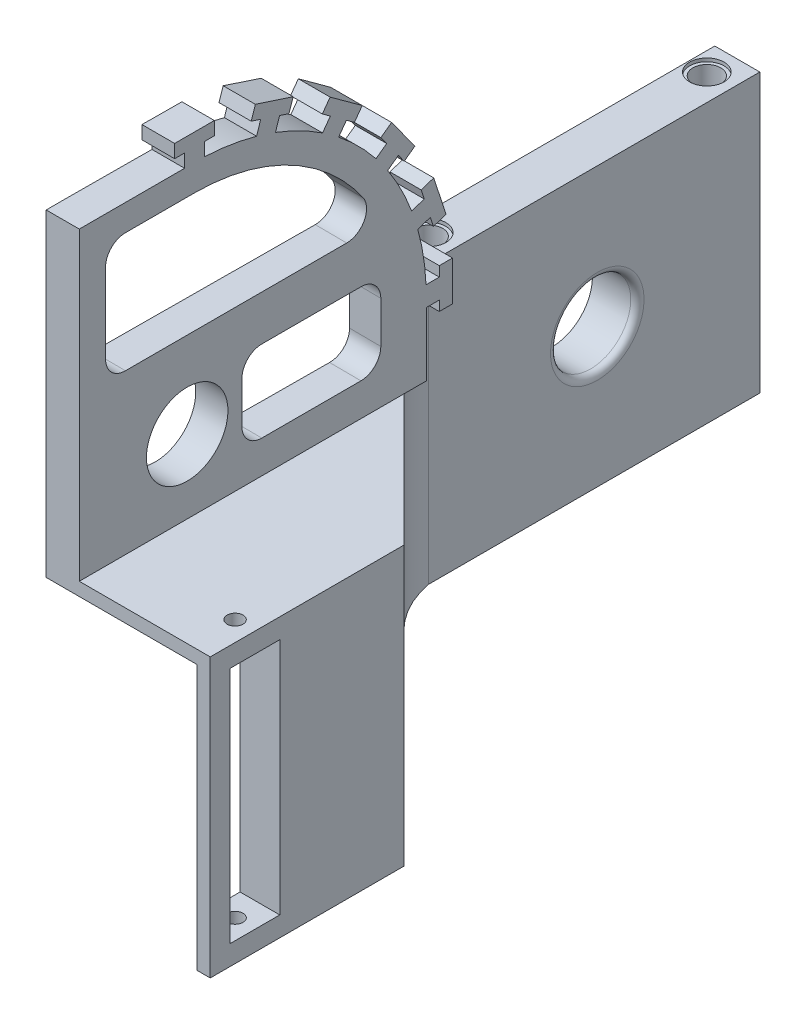
from build123d import *

# Parameters (mm, degrees)
SKETCH1_W           = 25
SKETCH1_H           = 50
SKETCH1_R           = 3.4
BOSS_EXTRUDE1_DEPTH = 3
SKETCH2_W           = 50
SKETCH2_H           = 3
BOSS_EXTRUDE2_DEPTH = 8
SKETCH3_W           = 8
SKETCH3_H           = 50
BOSS_EXTRUDE3_DEPTH = 42
SKETCH4_R           = 2.65
CUT_EXTRUDE1_DEPTH  = 0.5
SKETCH5_R           = 6.062177826
CUT_EXTRUDE2_DEPTH  = 9
FILLET2_R           = 1
SKETCH6_R           = 12.6
BOSS_EXTRUDE4_DEPTH = 2
FILLET4_R           = 1
SKETCH8_R           = 1.589780168
SKETCH8_R_2         = 1.777428262
CUT_EXTRUDE3_DEPTH  = 10
SKETCH9_W           = 49.021678163
SKETCH9_H           = 20.976854622
CUT_EXTRUDE4_DEPTH  = 68.79439129
SKETCH11_R          = 2.1
CUT_EXTRUDE5_DEPTH  = 59.480168703
SKETCH14_R          = 2.6
CUT_EXTRUDE6_DEPTH  = 0.5
BOSS_EXTRUDE5_DEPTH = 42
FILLET5_R           = 15
BOSS_EXTRUDE6_DEPTH = 42
SKETCH18_W          = 7.5
SKETCH18_H          = 36
CUT_EXTRUDE7_DEPTH  = 8
SKETCH19_R          = 1.2
CUT_EXTRUDE8_DEPTH  = 96.073366415
FILL_START          = -24.41711757
FILL_PATTERN1_DEPTH = 4.904046836
CHAMFER1_SIZE       = 4
CUT_EXTRUDE9_DEPTH  = 96.073366415
BOSS_EXTRUDE7_DEPTH = 2
BOSS_EXTRUDE8_DEPTH = 55
BOSS_EXTRUDE9_DEPTH = 4
SKETCH24_R          = 6.15
CUT_EXTRUDE10_DEPTH = 6
SKETCH25_W          = 50
SKETCH25_H          = 42
CUT_EXTRUDE11_DEPTH = 1.2
CUT_EXTRUDE14_DEPTH = 10
CUT_EXTRUDE15_DEPTH = 10


# Read off the part's stored shape, not the designer's step: Fill Pattern1
with BuildPart() as part:
    # Sketch1 → Boss-Extrude1 (new body)
    with BuildSketch(Plane(origin=(0, 0, 0), x_dir=(1, 0, 0), z_dir=(0, 1, 0))):
        with Locations((2.276951673, 11.384758364)):
            Rectangle(SKETCH1_W, SKETCH1_H)
        with Locations(Location((1.276951673, 11.384758364, 0), (0, 0, 270))):
            Circle(SKETCH1_R, mode=Mode.SUBTRACT)
    extrude(amount=BOSS_EXTRUDE1_DEPTH)

    # Sketch2 → Boss-Extrude2 (add)
    with BuildSketch(Plane.ZY.offset(10.223048327)):
        with Locations((-11.384758364, 1.5)):
            Rectangle(SKETCH2_W, SKETCH2_H)
    extrude(amount=BOSS_EXTRUDE2_DEPTH)

    # Sketch3 → Boss-Extrude3 (add)
    with BuildSketch(Plane.XZ):
        with Locations((-14.223048327, -11.384758364)):
            Rectangle(SKETCH3_W, SKETCH3_H)
    extrude(amount=BOSS_EXTRUDE3_DEPTH)

    # Sketch4 → Cut-Extrude1 (cut)
    with BuildSketch(Plane(origin=(0, 3, 0), x_dir=(1, 0, 0), z_dir=(0, 1, 0))):
        with Locations(Location((-14.223048327, 32.384758364, 0), (0, 0, 270))):
            Circle(SKETCH4_R)
        with Locations(Location((-14.223048327, -9.615241636, 0), (0, 0, 270))):
            Circle(SKETCH4_R)
    cut_extrude1 = extrude(amount=-CUT_EXTRUDE1_DEPTH, mode=Mode.SUBTRACT)

    # Mirror1: Cut-Extrude1 across plane
    add(cut_extrude1.mirror(Plane.ZX.offset(-19.5)), mode=Mode.SUBTRACT)

    # Sketch5 → Cut-Extrude2 (cut)
    with BuildSketch(Plane.ZY.offset(18.223048327)):
        with Locations((-11.836279124, -21)):
            Circle(SKETCH5_R)
    extrude(amount=-CUT_EXTRUDE2_DEPTH, mode=Mode.SUBTRACT)

    # Fillet2
    fillet2_edges = [part.edges().sort_by_distance(p)[0] for p in [
        (-10.223048327, -21, -17.89845695),
    ]]
    fillet(fillet2_edges, radius=FILLET2_R)

    # Mirror2: Cut-Extrude1 across plane
    add(cut_extrude1.mirror(Plane.ZY.offset(1.723048327)), mode=Mode.SUBTRACT)

    # Sketch6 → Boss-Extrude4 (add)
    with BuildSketch(Plane(origin=(0, 3, 0), x_dir=(1, 0, 0), z_dir=(0, 1, 0))):
        with BuildLine():
            Line((14.776951673, 5.825082115), (14.776951673, 16.944434614))
            ThreePointArc((14.776951673, 16.944434614), (-13.323048327, 11.384758364), (14.776951673, 5.825082115))
        make_face()
        with Locations(Location((1.276951673, 11.384758364, 0), (0, 0, 270))):
            Circle(SKETCH6_R, mode=Mode.SUBTRACT)
    extrude(amount=BOSS_EXTRUDE4_DEPTH)

    # Fillet4
    # the kernel refuses this fillet: 1 mm, written as the material it takes off along each edge
    with BuildSketch(Plane(origin=(14.776951673, 5, -3.325082115), x_dir=(0, -1, 0), z_dir=(0, 0, -1))) as fillet4_piece_1:
        with BuildLine():
            CenterArc((FILLET4_R, FILLET4_R), FILLET4_R, 180, 90)
            Line((0, FILLET4_R), (0, 0))
            Line((0, 0), (FILLET4_R, 0))
        make_face()
    extrude(amount=16.119352499, mode=Mode.SUBTRACT)

    # Sketch8 → Cut-Extrude3 (cut)
    with BuildSketch(Plane(origin=(0, 3, 0), x_dir=(1, 0, 0), z_dir=(0, 1, 0))):
        with Locations(Location((1.276951673, 19.884758364, 0), (0, 0, 270))):
            Circle(SKETCH8_R)
        with Locations(Location((1.276951673, 2.884758364, 0), (0, 0, 270))):
            Circle(SKETCH8_R_2)
    extrude(amount=-CUT_EXTRUDE3_DEPTH, mode=Mode.SUBTRACT)

    # Sketch9 → Cut-Extrude4 (cut, through all)
    with BuildSketch(Plane.XY.offset(13.615241636)):
        with Locations((-9.733887409, 10.488427311)):
            Rectangle(SKETCH9_W, SKETCH9_H)
    extrude(amount=-CUT_EXTRUDE4_DEPTH, mode=Mode.SUBTRACT)

    # Sketch11 → Cut-Extrude5 (cut, through all)
    with BuildSketch(Plane(origin=(0, 0, 0), x_dir=(1, 0, 0), z_dir=(0, 1, 0))):
        with Locations(Location((-14.223048327, 32.384758364, 0), (0, 0, 270))):
            Circle(SKETCH11_R)
    cut_extrude5 = extrude(amount=-CUT_EXTRUDE5_DEPTH, mode=Mode.SUBTRACT)

    # Mirror3: Cut-Extrude5 across plane
    add(cut_extrude5.mirror(Plane.XY.offset(-11.384758364)), mode=Mode.SUBTRACT)

    # Sketch14 → Cut-Extrude6 (cut)
    with BuildSketch(Plane(origin=(0, 0, 0), x_dir=(1, 0, 0), z_dir=(0, 1, 0))):
        with Locations(Location((-14.223048327, -9.615241636, 0), (0, 0, 270))):
            Circle(SKETCH14_R)
    cut_extrude6 = extrude(amount=-CUT_EXTRUDE6_DEPTH, mode=Mode.SUBTRACT)

    # Mirror4: Cut-Extrude6 across plane
    add(cut_extrude6.mirror(Plane.XY.offset(-11.384758364)), mode=Mode.SUBTRACT)

    # Sketch16 → Boss-Extrude5 (add)
    with BuildSketch(Plane(origin=(0, 0, 0), x_dir=(1, 0, 0), z_dir=(0, 1, 0))):
        Polygon((-18.223048327, -13.615241636), (24.776951673, -56.615241636), (24.776951673, -52.372600949), (-13.98040764, -13.615241636), align=None)
    extrude(amount=-BOSS_EXTRUDE5_DEPTH)

    # Fillet5
    # the kernel refuses this fillet: 15 mm, written as the material it adds along each edge
    with BuildSketch(Plane(origin=(-13.98040764, 0, 13.615241636), x_dir=(1, 0, 0), z_dir=(0, -1, 0))) as fillet5_piece_1:
        with BuildLine():
            CenterArc((18.512169169, -2.701034267), FILLET5_R, 135, 34.626223963)
            Line((7.905567451, 7.905567451), (0, 0))
            Line((0, 0), (3.757359313, 0))
        make_face()
    extrude(amount=42)

    # Sketch17 → Boss-Extrude6 (add)
    with BuildSketch(Plane(origin=(0, 0, 0), x_dir=(1, 0, 0), z_dir=(0, 1, 0))):
        Polygon((24.776951673, -56.615241636), (24.776951673, -81.615241636), (18.776951673, -81.615241636), (18.776951673, -50.615241636), align=None)
    extrude(amount=-BOSS_EXTRUDE6_DEPTH)

    # Sketch18 → Cut-Extrude7 (cut)
    with BuildSketch(Plane(origin=(24.776951673, 0, 0), x_dir=(0, 0, -1), z_dir=(1, 0, 0))):
        with Locations((-74.865241636, -21)):
            Rectangle(SKETCH18_W, SKETCH18_H)
    extrude(amount=-CUT_EXTRUDE7_DEPTH, mode=Mode.SUBTRACT)

    # Sketch19 → Cut-Extrude8 (cut, through all)
    with BuildSketch(Plane(origin=(0, 0, 0), x_dir=(1, 0, 0), z_dir=(0, 1, 0))):
        with Locations(Location((21.776951673, -74.865241636, 0), (0, 0, 270))):
            Circle(SKETCH19_R)
    extrude(amount=-CUT_EXTRUDE8_DEPTH, mode=Mode.SUBTRACT)

    # Fill Pattern1 outline → Fill Pattern1 (cut)
    with BuildSketch(Plane(origin=(0, 0, 0), x_dir=(0.7071067811865468, 0, 0.7071067811865482), z_dir=(0.7071067811865481, 0, -0.707106781186547)).offset(FILL_START)):
        Polygon((45.971737286, 5.859685187), (47.221737286, 3.694621678), (49.721737286, 3.694621678), (50.971737286, 5.859685187), (49.721737286, 8.024748697), (47.221737286, 8.024748697), align=None)
        Polygon((30.237460587, 33.11225185), (31.487460587, 30.947188341), (33.987460587, 30.947188341), (35.237460587, 33.11225185), (33.987460587, 35.27731536), (31.487460587, 35.27731536), align=None)
        Polygon((40.726978386, 14.943874075), (41.976978386, 12.778810565), (44.476978386, 12.778810565), (45.726978386, 14.943874075), (44.476978386, 17.108937584), (41.976978386, 17.108937584), align=None)
        Polygon((35.482219487, 24.028062963), (36.732219487, 21.862999453), (39.232219487, 21.862999453), (40.482219487, 24.028062963), (39.232219487, 26.193126472), (36.732219487, 26.193126472), align=None)
        Polygon((15.753183888, 3.694621678), (18.253183888, 3.694621678), (19.503183888, 5.859685187), (18.253183888, 8.024748697), (15.753183888, 8.024748697), (14.503183888, 5.859685187), align=None)
        Polygon((26.242701687, 3.694621678), (28.742701687, 3.694621678), (29.992701687, 5.859685187), (28.742701687, 8.024748697), (26.242701687, 8.024748697), (24.992701687, 5.859685187), align=None)
        Polygon((36.732219487, 3.694621678), (39.232219487, 3.694621678), (40.482219487, 5.859685187), (39.232219487, 8.024748697), (36.732219487, 8.024748697), (35.482219487, 5.859685187), align=None)
        Polygon((45.971737286, 11.915811112), (47.221737286, 9.750747603), (49.721737286, 9.750747603), (50.971737286, 11.915811112), (49.721737286, 14.080874622), (47.221737286, 14.080874622), align=None)
        Polygon((40.726978386, 21), (41.976978386, 18.834936491), (44.476978386, 18.834936491), (45.726978386, 21), (44.476978386, 23.165063509), (41.976978386, 23.165063509), align=None)
        Polygon((35.482219487, 30.084188888), (36.732219487, 27.919125378), (39.232219487, 27.919125378), (40.482219487, 30.084188888), (39.232219487, 32.249252397), (36.732219487, 32.249252397), align=None)
        Polygon((15.753183888, 9.750747603), (18.253183888, 9.750747603), (19.503183888, 11.915811112), (18.253183888, 14.080874622), (15.753183888, 14.080874622), (14.503183888, 11.915811112), align=None)
        Polygon((26.242701687, 9.750747603), (28.742701687, 9.750747603), (29.992701687, 11.915811112), (28.742701687, 14.080874622), (26.242701687, 14.080874622), (24.992701687, 11.915811112), align=None)
        Polygon((36.732219487, 9.750747603), (39.232219487, 9.750747603), (40.482219487, 11.915811112), (39.232219487, 14.080874622), (36.732219487, 14.080874622), (35.482219487, 11.915811112), align=None)
        Polygon((45.971737286, 17.971937037), (47.221737286, 15.806873528), (49.721737286, 15.806873528), (50.971737286, 17.971937037), (49.721737286, 20.137000547), (47.221737286, 20.137000547), align=None)
        Polygon((40.726978386, 27.056125925), (41.976978386, 24.891062416), (44.476978386, 24.891062416), (45.726978386, 27.056125925), (44.476978386, 29.221189435), (41.976978386, 29.221189435), align=None)
        Polygon((35.482219487, 36.140314813), (36.732219487, 33.975251303), (39.232219487, 33.975251303), (40.482219487, 36.140314813), (39.232219487, 38.305378322), (36.732219487, 38.305378322), align=None)
        Polygon((15.753183888, 15.806873528), (18.253183888, 15.806873528), (19.503183888, 17.971937037), (18.253183888, 20.137000547), (15.753183888, 20.137000547), (14.503183888, 17.971937037), align=None)
        Polygon((26.242701687, 15.806873528), (28.742701687, 15.806873528), (29.992701687, 17.971937037), (28.742701687, 20.137000547), (26.242701687, 20.137000547), (24.992701687, 17.971937037), align=None)
        Polygon((36.732219487, 15.806873528), (39.232219487, 15.806873528), (40.482219487, 17.971937037), (39.232219487, 20.137000547), (36.732219487, 20.137000547), (35.482219487, 17.971937037), align=None)
        Polygon((44.476978386, 6.72268464), (45.726978386, 8.88774815), (44.476978386, 11.052811659), (41.976978386, 11.052811659), (40.726978386, 8.88774815), (41.976978386, 6.72268464), align=None)
        Polygon((45.971737286, 24.028062963), (47.221737286, 21.862999453), (49.721737286, 21.862999453), (50.971737286, 24.028062963), (49.721737286, 26.193126472), (47.221737286, 26.193126472), align=None)
        Polygon((40.726978386, 33.11225185), (41.976978386, 30.947188341), (44.476978386, 30.947188341), (45.726978386, 33.11225185), (44.476978386, 35.27731536), (41.976978386, 35.27731536), align=None)
        Polygon((15.753183888, 21.862999453), (18.253183888, 21.862999453), (19.503183888, 24.028062963), (18.253183888, 26.193126472), (15.753183888, 26.193126472), (14.503183888, 24.028062963), align=None)
        Polygon((26.242701687, 21.862999453), (28.742701687, 21.862999453), (29.992701687, 24.028062963), (28.742701687, 26.193126472), (26.242701687, 26.193126472), (24.992701687, 24.028062963), align=None)
        Polygon((45.971737286, 36.140314813), (47.221737286, 33.975251303), (49.721737286, 33.975251303), (50.971737286, 36.140314813), (49.721737286, 38.305378322), (47.221737286, 38.305378322), align=None)
        Polygon((15.753183888, 33.975251303), (18.253183888, 33.975251303), (19.503183888, 36.140314813), (18.253183888, 38.305378322), (15.753183888, 38.305378322), (14.503183888, 36.140314813), align=None)
        Polygon((26.242701687, 33.975251303), (28.742701687, 33.975251303), (29.992701687, 36.140314813), (28.742701687, 38.305378322), (26.242701687, 38.305378322), (24.992701687, 36.140314813), align=None)
        Polygon((33.987460587, 6.72268464), (35.237460587, 8.88774815), (33.987460587, 11.052811659), (31.487460587, 11.052811659), (30.237460587, 8.88774815), (31.487460587, 6.72268464), align=None)
        Polygon((45.971737286, 30.084188888), (47.221737286, 27.919125378), (49.721737286, 27.919125378), (50.971737286, 30.084188888), (49.721737286, 32.249252397), (47.221737286, 32.249252397), align=None)
        Polygon((15.753183888, 27.919125378), (18.253183888, 27.919125378), (19.503183888, 30.084188888), (18.253183888, 32.249252397), (15.753183888, 32.249252397), (14.503183888, 30.084188888), align=None)
        Polygon((26.242701687, 27.919125378), (28.742701687, 27.919125378), (29.992701687, 30.084188888), (28.742701687, 32.249252397), (26.242701687, 32.249252397), (24.992701687, 30.084188888), align=None)
        Polygon((19.747942788, 27.056125925), (20.997942788, 24.891062416), (23.497942788, 24.891062416), (24.747942788, 27.056125925), (23.497942788, 29.221189435), (20.997942788, 29.221189435), align=None)
        Polygon((19.747942788, 8.88774815), (20.997942788, 6.72268464), (23.497942788, 6.72268464), (24.747942788, 8.88774815), (23.497942788, 11.052811659), (20.997942788, 11.052811659), align=None)
        Polygon((33.987460587, 24.891062416), (35.237460587, 27.056125925), (33.987460587, 29.221189435), (31.487460587, 29.221189435), (30.237460587, 27.056125925), (31.487460587, 24.891062416), align=None)
        Polygon((19.747942788, 14.943874075), (20.997942788, 12.778810565), (23.497942788, 12.778810565), (24.747942788, 14.943874075), (23.497942788, 17.108937584), (20.997942788, 17.108937584), align=None)
        Polygon((31.487460587, 12.778810565), (33.987460587, 12.778810565), (35.237460587, 14.943874075), (33.987460587, 17.108937584), (31.487460587, 17.108937584), (30.237460587, 14.943874075), align=None)
        Polygon((19.747942788, 21), (20.997942788, 18.834936491), (23.497942788, 18.834936491), (24.747942788, 21), (23.497942788, 23.165063509), (20.997942788, 23.165063509), align=None)
        Polygon((31.487460587, 18.834936491), (33.987460587, 18.834936491), (35.237460587, 21), (33.987460587, 23.165063509), (31.487460587, 23.165063509), (30.237460587, 21), align=None)
        Polygon((20.997942788, 30.947188341), (23.497942788, 30.947188341), (24.747942788, 33.11225185), (23.497942788, 35.27731536), (20.997942788, 35.27731536), (19.747942788, 33.11225185), align=None)
    extrude(amount=FILL_PATTERN1_DEPTH, mode=Mode.SUBTRACT)

    # Chamfer1
    # the kernel refuses this chamfer: 4 mm, written as the material it takes off along each edge
    with BuildSketch(Plane(origin=(18.776951673, 10.286731952, 81.615241636), x_dir=(0.9996219169112968, 0, 0.027495876610585623), z_dir=(0, -1, 0))) as chamfer1_piece_1:
        Polygon((CHAMFER1_SIZE * 0.999621916911, -CHAMFER1_SIZE * 0.0274958766106), (-CHAMFER1_SIZE * 0.0274958766106, -CHAMFER1_SIZE * 0.999621916911), (0, 0), align=None)
    extrude(amount=62.573463904, mode=Mode.SUBTRACT)

    # Sketch20 → Cut-Extrude9 (cut, through all)
    with BuildSketch(Plane(origin=(0, 0, 0), x_dir=(1, 0, 0), z_dir=(0, 1, 0))):
        Polygon((-12.007369699, -13.422049918), (-13.646299524, -15.19356362), (-10.796749548, -17.829847178), (-10.525107778, -17.536230508), (-13.131913788, -15.124523438), (-11.876337797, -13.615241636), align=None)
    extrude(amount=-CUT_EXTRUDE9_DEPTH, mode=Mode.SUBTRACT)

    # Sketch21 → Boss-Extrude7 (add)
    with BuildSketch(Plane(origin=(0, 0, 0), x_dir=(1, 0, 0), z_dir=(0, 1, 0))):
        Polygon((18.776951673, -77.615241636), (0, -77.615241636), (0.276951673, -32.115241636), (18.776951673, -50.615241636), align=None)
    extrude(amount=-BOSS_EXTRUDE7_DEPTH)

    # Sketch22 → Boss-Extrude8 (add)
    with BuildSketch(Plane(origin=(0, 0, 0), x_dir=(1, 0, 0), z_dir=(0, 1, 0))):
        Polygon((0, -77.615241636), (0.276951673, -32.115241636), (0.276951673, -27.872600949), (0.276951673, -22.238918045), (5, -22.238918045), (5, -32.595649276), (5, -77.615241636), align=None)
    extrude(amount=BOSS_EXTRUDE8_DEPTH)

    # Sketch23 → Boss-Extrude9 (add)
    with BuildSketch(Plane.XY.offset(81.615241636)):
        Polygon((22.776951673, 0), (5, 0), (5, 55), (0, 55), (0, -2), (22.776951673, -2), align=None)
    extrude(amount=-BOSS_EXTRUDE9_DEPTH)

    # Sketch24 → Cut-Extrude10 (cut)
    with BuildSketch(Plane(origin=(0.472414827, 0, 0.002875518), x_dir=(-0.006086737198043909, 0, 0.9999814756435651), z_dir=(-0.9999814756435652, 0, -0.0060867371980439094))):
        with Locations((65.287447005, 11.100907392)):
            Circle(SKETCH24_R)
    extrude(amount=-CUT_EXTRUDE10_DEPTH, mode=Mode.SUBTRACT)

    # Sketch25 → Cut-Extrude11 (cut)
    with BuildSketch(Plane.ZY.offset(18.223048327)):
        with Locations((-11.384758364, -21)):
            Rectangle(SKETCH25_W, SKETCH25_H)
    extrude(amount=-CUT_EXTRUDE11_DEPTH, mode=Mode.SUBTRACT)

    # Sketch29 → Cut-Extrude14 (cut)
    with BuildSketch(Plane.ZY):
        with BuildLine():
            Line((29.215241636, 0), (29.215241636, 9.600907392))
            Line((29.215241636, 9.600907392), (27.247399266, 9.600907392))
            Line((27.247399266, 9.600907392), (27.247399266, 8.100907392))
            Line((27.247399266, 8.100907392), (25.247399266, 8.100907392))
            Line((25.247399266, 8.100907392), (25.247399266, 14.100907392))
            Line((25.247399266, 14.100907392), (27.247399266, 14.100907392))
            Line((27.247399266, 14.100907392), (27.247399266, 12.600907392))
            Line((27.247399266, 12.600907392), (29.247399266, 12.600907392))
            ThreePointArc((29.247399266, 12.600907392), (29.646149715, 16.576113669), (30.495321798, 20.479980167))
            Line((30.495321798, 20.479980167), (28.593208765, 21.098014155))
            Line((28.593208765, 21.098014155), (28.129683273, 19.671429381))
            Line((28.129683273, 19.671429381), (26.227570241, 20.28946337))
            Line((26.227570241, 20.28946337), (28.081672207, 25.995802467))
            Line((28.081672207, 25.995802467), (29.98378524, 25.377768479))
            Line((29.98378524, 25.377768479), (29.520259748, 23.951183704))
            Line((29.520259748, 23.951183704), (31.422372781, 23.333149715))
            ThreePointArc((31.422372781, 23.333149715), (33.030013289, 26.990574883), (35.043985023, 30.44096395))
            Line((35.043985023, 30.44096395), (33.425951035, 31.616534455))
            Line((33.425951035, 31.616534455), (32.544273156, 30.403008963))
            Line((32.544273156, 30.403008963), (30.926239168, 31.578579468))
            Line((30.926239168, 31.578579468), (34.452950681, 36.432681434))
            Line((34.452950681, 36.432681434), (36.07098467, 35.257110929))
            Line((36.07098467, 35.257110929), (35.189306792, 34.043585438))
            Line((35.189306792, 34.043585438), (36.80734078, 32.868014933))
            ThreePointArc((36.80734078, 32.868014933), (39.466504294, 35.849644734), (42.448134095, 38.508808247))
            Line((42.448134095, 38.508808247), (41.27256359, 40.126842236))
            Line((41.27256359, 40.126842236), (40.059038099, 39.245164358))
            Line((40.059038099, 39.245164358), (38.883467594, 40.863198347))
            Line((38.883467594, 40.863198347), (43.73756956, 44.38990986))
            Line((43.73756956, 44.38990986), (44.913140065, 42.771875872))
            Line((44.913140065, 42.771875872), (43.699614573, 41.890197993))
            Line((43.699614573, 41.890197993), (44.875185078, 40.272164004))
            ThreePointArc((44.875185078, 40.272164004), (46.710340065, 41.408966073), (48.612086738, 42.430471022))
            Line((48.612086738, 42.430471022), (48.59152354, 51.357764588))
            Line((48.59152354, 51.357764588), (77.615241636, 51.424618048))
            Line((77.615241636, 51.424618048), (77.615241636, 55))
            Line((77.615241636, 55), (81.615241636, 55))
            Line((81.615241636, 55), (81.615241636, 51.433831679))
            Line((81.615241636, 51.433831679), (109.775023298, 51.498695141))
            Line((109.775023298, 51.498695141), (109.905023298, 46.068749762))
            Line((109.905023298, 46.068749762), (111.053387507, 61.175010565))
            Line((111.053387507, 61.175010565), (21.989227837, 61.175010565))
            Line((21.989227837, 61.175010565), (21.989227837, 0))
            Line((21.989227837, 0), (29.215241636, 0))
        make_face()
        with BuildLine():
            Line((48.59152354, 51.357764588), (48.612086738, 42.430471022))
            ThreePointArc((48.612086738, 42.430471022), (50.278324826, 43.206395238), (51.982999312, 43.893776247))
            Line((51.982999312, 43.893776247), (51.364965324, 45.79588928))
            Line((51.364965324, 45.79588928), (49.938380549, 45.332363788))
            Line((49.938380549, 45.332363788), (49.32034656, 47.234476821))
            Line((49.32034656, 47.234476821), (55.026685658, 49.088578787))
            Line((55.026685658, 49.088578787), (55.644719647, 47.186465754))
            Line((55.644719647, 47.186465754), (54.218134872, 46.722940263))
            Line((54.218134872, 46.722940263), (54.836168861, 44.82082723))
            ThreePointArc((54.836168861, 44.82082723), (58.740035359, 45.669999313), (62.715241636, 46.068749762))
            Line((62.715241636, 46.068749762), (62.715241636, 48.068749762))
            Line((62.715241636, 48.068749762), (61.215241636, 48.068749762))
            Line((61.215241636, 48.068749762), (61.215241636, 50.068749762))
            Line((61.215241636, 50.068749762), (67.215241636, 50.068749762))
            Line((67.215241636, 50.068749762), (67.215241636, 48.068749762))
            Line((67.215241636, 48.068749762), (65.715241636, 48.068749762))
            Line((65.715241636, 48.068749762), (65.715241636, 46.068749762))
            Line((65.715241636, 46.068749762), (77.615241636, 46.068749762))
            Line((77.615241636, 46.068749762), (77.615241636, 51.424618048))
            Line((77.615241636, 51.424618048), (48.59152354, 51.357764588))
        make_face()
        Polygon((81.615241636, 51.433831679), (77.615241636, 51.424618048), (77.615241636, 46.068749762), (81.615241636, 46.068749762), align=None)
        Polygon((77.615241636, 55), (77.615241636, 51.424618048), (81.615241636, 51.433831679), (81.615241636, 55), align=None)
    extrude(amount=-CUT_EXTRUDE14_DEPTH, mode=Mode.SUBTRACT)

    # Sketch30 → Cut-Extrude15 (cut)
    with BuildSketch(Plane(origin=(0.472414827, 0, 0.002875518), x_dir=(-0.006086737198043909, 0, 0.9999814756435651), z_dir=(-0.9999814756435652, 0, -0.0060867371980439094))):
        with BuildLine():
            ThreePointArc((77.613729766, 27.052513407), (76.735050109, 24.931193063), (74.613729766, 24.052513407))
            Line((74.613729766, 24.052513407), (44.887063346, 24.052513407))
            Line((44.887063346, 24.052513407), (41.201711146, 24.052513407))
            ThreePointArc((41.201711146, 24.052513407), (38.543958153, 25.660985817), (38.736153402, 28.761614051))
            ThreePointArc((38.736153402, 28.761614051), (49.834464991, 38.564354976), (64.213583419, 42.100907392))
            Line((64.213583419, 42.100907392), (74.613729766, 42.100907392))
            ThreePointArc((74.613729766, 42.100907392), (76.735050109, 41.222227736), (77.613729766, 39.100907392))
            Line((77.613729766, 39.100907392), (77.613729766, 27.052513407))
        make_face()
        with BuildLine():
            Line((36.048784438, 11.100907392), (57.022318144, 11.100907392))
            Line((57.022318144, 11.100907392), (57.022318144, 14.250907392))
            ThreePointArc((57.022318144, 14.250907392), (56.143638488, 16.372227736), (54.022318144, 17.250907392))
            Line((54.022318144, 17.250907392), (39.048784438, 17.250907392))
            ThreePointArc((39.048784438, 17.250907392), (36.927464095, 16.372227736), (36.048784438, 14.250907392))
            Line((36.048784438, 14.250907392), (36.048784438, 11.100907392))
        make_face()
        with BuildLine():
            Line((57.022318144, 7.950907392), (57.022318144, 11.100907392))
            Line((57.022318144, 11.100907392), (36.048784438, 11.100907392))
            Line((36.048784438, 11.100907392), (36.048784438, 7.950907392))
            ThreePointArc((36.048784438, 7.950907392), (36.927464095, 5.829587049), (39.048784438, 4.950907392))
            Line((39.048784438, 4.950907392), (54.022318144, 4.950907392))
            ThreePointArc((54.022318144, 4.950907392), (56.143638488, 5.829587049), (57.022318144, 7.950907392))
        make_face()
    extrude(amount=-CUT_EXTRUDE15_DEPTH, mode=Mode.SUBTRACT)


solid = part.part
